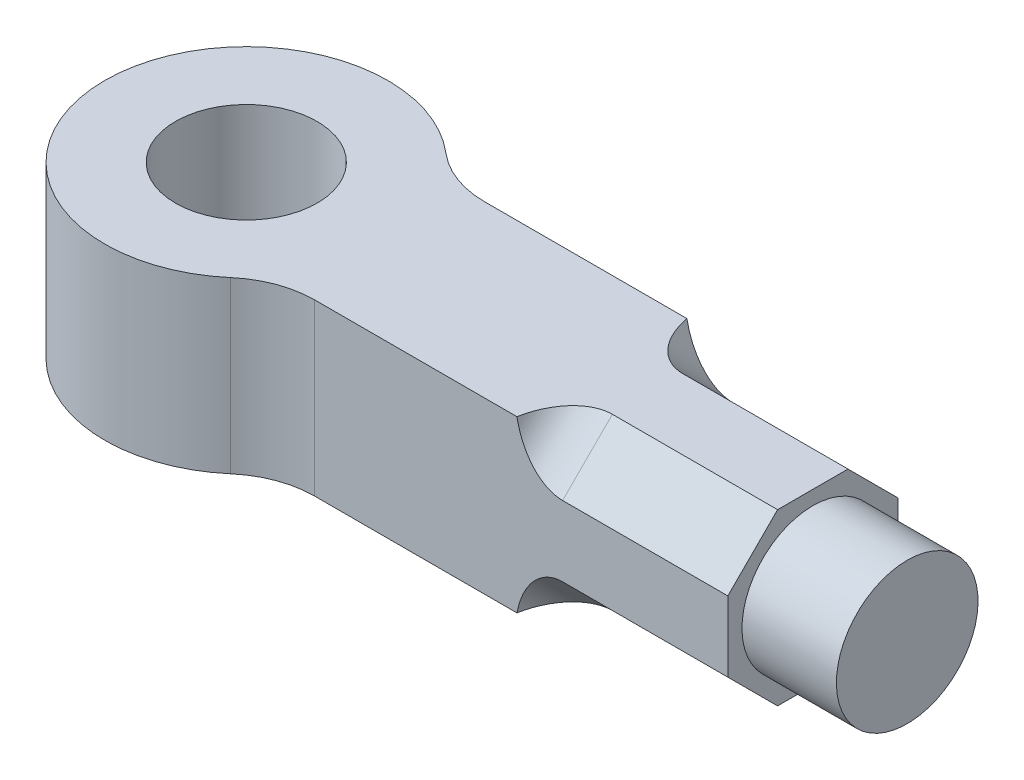
from build123d import *

# Parameters (mm, degrees)
CROQUIS1_R              = 15
SALIENTE_EXTRUIR2_DEPTH = 18
SALIENTE_EXTRUIR3_DEPTH = 45
REDONDEO1_R             = 10
REDONDEO2_R             = 20
CROQUIS3_R              = 15
SALIENTE_EXTRUIR4_DEPTH = 20


with BuildPart() as part:
    # Croquis1 → Saliente-Extruir2 (new, symmetric)
    with BuildSketch(Plane(origin=(0, 0, 0), x_dir=(1, 0, 0), z_dir=(0, 1, 0))):
        with BuildLine():
            Line((24, -18), (75, -18))
            Line((75, -18), (75, 18))
            Line((75, 18), (24, 18))
            ThreePointArc((24, 18), (-30, 0), (24, -18))
        make_face()
        with Locations(Location((0, 0, 0), (0, 0, 270))):
            Circle(CROQUIS1_R, mode=Mode.SUBTRACT)
    extrude(amount=SALIENTE_EXTRUIR2_DEPTH, both=True)

    # Croquis2 → Saliente-Extruir3 (add)
    with BuildSketch(Plane(origin=(75, 0, 0), x_dir=(0, 0, -1), z_dir=(1, 0, 0))):
        Polygon((-18, -7.455844123), (-7.455844123, -18), (7.455844123, -18), (18, -7.455844123), (18, 7.455844123), (7.455844123, 18), (-7.455844123, 18), (-18, 7.455844123), align=None)
    extrude(amount=SALIENTE_EXTRUIR3_DEPTH)

    # Redondeo1
    # the kernel refuses this fillet: 10 mm, written as the material it adds along each edge
    with BuildSketch(Plane(origin=(75, 10.221825407, 35.67766953), x_dir=(-1.4210854715202005e-15, -0.7071067811865512, 0.7071067811865439), z_dir=(0, -0.7071067811865439, -0.7071067811865512))) as redondeo1_piece_1_section:
        with BuildLine():
            CenterArc((REDONDEO1_R, -REDONDEO1_R), REDONDEO1_R, 90, 90)
            Line((0, -REDONDEO1_R), (0, 0))
            Line((0, 0), (REDONDEO1_R, 0))
        make_face()
    redondeo1_piece_1 = extrude(amount=64.911688245, mode=Mode.PRIVATE)
    redondeo1_piece_1 = split(redondeo1_piece_1, bisect_by=Plane(origin=(77.775136413, -18, 13.729156697), z_dir=(0, 1, 0)), keep=Keep.TOP, mode=Mode.PRIVATE)
    redondeo1_piece_1 = split(redondeo1_piece_1, bisect_by=Plane(origin=(77.775136413, -13.729156697, 18), z_dir=(0, 0, -1)), keep=Keep.TOP, mode=Mode.PRIVATE)
    add(redondeo1_piece_1)
    with BuildSketch(Plane(origin=(75, -35.67766953, 10.221825407), x_dir=(0, -0.707106781186544, -0.7071067811865511), z_dir=(0, 0.7071067811865511, -0.7071067811865441))) as redondeo1_piece_2_section:
        with BuildLine():
            CenterArc((REDONDEO1_R, -REDONDEO1_R), REDONDEO1_R, 90, 90)
            Line((0, -REDONDEO1_R), (0, 0))
            Line((0, 0), (REDONDEO1_R, 0))
        make_face()
    redondeo1_piece_2 = extrude(amount=64.911688245, mode=Mode.PRIVATE)
    redondeo1_piece_2 = split(redondeo1_piece_2, bisect_by=Plane(origin=(77.775136413, -18, -13.729156697), z_dir=(0, 1, 0)), keep=Keep.TOP, mode=Mode.PRIVATE)
    redondeo1_piece_2 = split(redondeo1_piece_2, bisect_by=Plane(origin=(77.775136413, -13.729156697, -18), z_dir=(0, 0, 1)), keep=Keep.TOP, mode=Mode.PRIVATE)
    add(redondeo1_piece_2)
    with BuildSketch(Plane(origin=(75, -10.221825407, -35.67766953), x_dir=(1.421085471520201e-15, 0.7071067811865511, -0.7071067811865439), z_dir=(0, 0.7071067811865439, 0.7071067811865511))) as redondeo1_piece_3_section:
        with BuildLine():
            CenterArc((REDONDEO1_R, -REDONDEO1_R), REDONDEO1_R, 90, 90)
            Line((0, -REDONDEO1_R), (0, 0))
            Line((0, 0), (REDONDEO1_R, 0))
        make_face()
    redondeo1_piece_3 = extrude(amount=64.911688245, mode=Mode.PRIVATE)
    redondeo1_piece_3 = split(redondeo1_piece_3, bisect_by=Plane(origin=(77.775136413, 18, -13.729156697), z_dir=(0, -1, 0)), keep=Keep.TOP, mode=Mode.PRIVATE)
    redondeo1_piece_3 = split(redondeo1_piece_3, bisect_by=Plane(origin=(77.775136413, 13.729156697, -18), z_dir=(0, 0, 1)), keep=Keep.TOP, mode=Mode.PRIVATE)
    add(redondeo1_piece_3)
    with BuildSketch(Plane(origin=(75, 35.67766953, -10.221825407), x_dir=(0, 0.7071067811865458, 0.7071067811865493), z_dir=(0, -0.7071067811865493, 0.7071067811865458))) as redondeo1_piece_4_section:
        with BuildLine():
            CenterArc((REDONDEO1_R, -REDONDEO1_R), REDONDEO1_R, 90, 90)
            Line((0, -REDONDEO1_R), (0, 0))
            Line((0, 0), (REDONDEO1_R, 0))
        make_face()
    redondeo1_piece_4 = extrude(amount=64.911688245, mode=Mode.PRIVATE)
    redondeo1_piece_4 = split(redondeo1_piece_4, bisect_by=Plane(origin=(77.775136413, 13.729156697, 18), z_dir=(0, 0, -1)), keep=Keep.TOP, mode=Mode.PRIVATE)
    redondeo1_piece_4 = split(redondeo1_piece_4, bisect_by=Plane(origin=(77.775136413, 18, 13.729156697), z_dir=(0, -1, 0)), keep=Keep.TOP, mode=Mode.PRIVATE)
    add(redondeo1_piece_4)

    # Redondeo2
    redondeo2_edges = [part.edges().sort_by_distance(p)[0] for p in [
        (24, 0, 18),
        (24, 0, -18),
    ]]
    fillet(redondeo2_edges, radius=REDONDEO2_R)

    # Croquis3 → Saliente-Extruir4 (add)
    with BuildSketch(Plane(origin=(120, 0, 0), x_dir=(0, 0, -1), z_dir=(1, 0, 0))):
        with Locations(Location((0, 0, 0), (0, 0, 90))):
            Circle(CROQUIS3_R)
    extrude(amount=SALIENTE_EXTRUIR4_DEPTH)


solid = part.part
